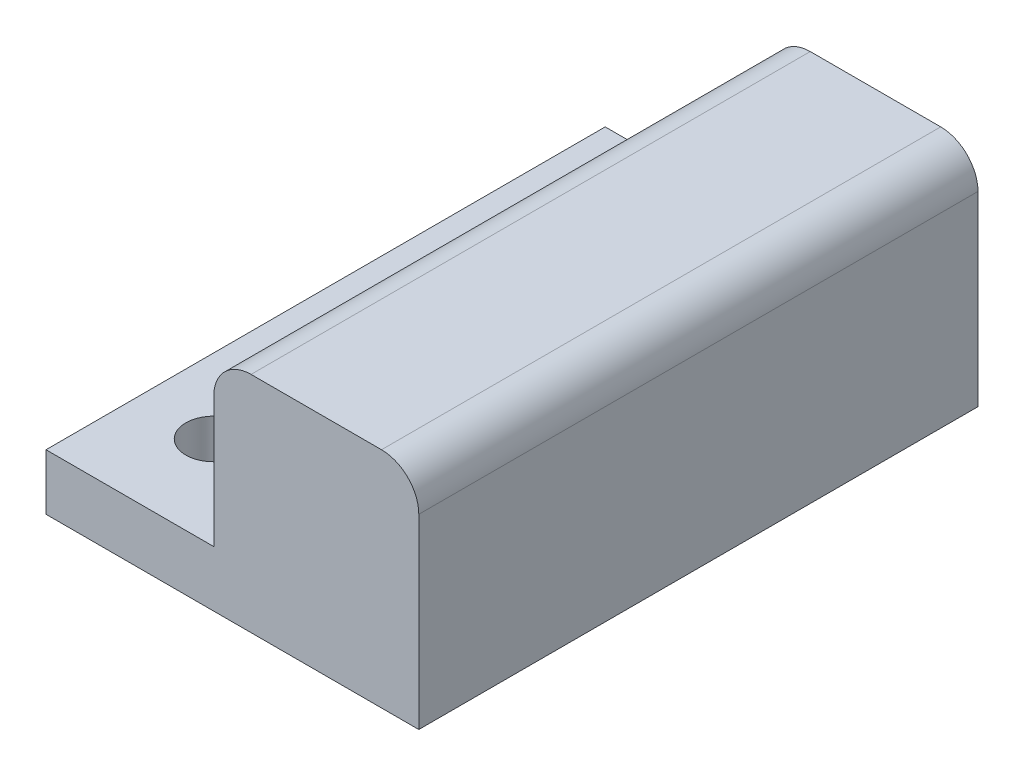
from build123d import *

# Parameters (mm, degrees)
SKETCH1_W           = 25.4
SKETCH1_H           = 38.1
SKETCH1_R           = 1.905
BOSS_EXTRUDE1_DEPTH = 3.81
BOSS_EXTRUDE2_DEPTH = 8.89
SKETCH3_W           = 13.97
SKETCH3_H           = 38.1
BOSS_EXTRUDE3_DEPTH = 2.54
CHAMFER1_SIZE       = 1.27
FILLET1_R           = 2.54


with BuildPart() as part:
    # Sketch1 → Boss-Extrude1 (new body)
    with BuildSketch(Plane(origin=(0, 0, 0), x_dir=(1, 0, 0), z_dir=(0, 1, 0))):
        with Locations((-7.62, -12.7)):
            Rectangle(SKETCH1_W, SKETCH1_H)
        Circle(SKETCH1_R, mode=Mode.SUBTRACT)
        with Locations((0, -25.4)):
            Circle(SKETCH1_R, mode=Mode.SUBTRACT)
    extrude(amount=BOSS_EXTRUDE1_DEPTH)

    # Sketch2 → Boss-Extrude2 (add)
    with BuildSketch(Plane(origin=(0, 3.81, 0), x_dir=(1, 0, 0), z_dir=(0, 1, 0))):
        Polygon((-20.32, 6.35), (-20.32, -31.75), (-6.35, -31.75), (-6.35, 6.35), (-8.89, 6.35), (-8.89, -29.21), (-17.78, -29.21), (-17.78, 6.35), align=None)
    extrude(amount=BOSS_EXTRUDE2_DEPTH)

    # Sketch3 → Boss-Extrude3 (add)
    with BuildSketch(Plane(origin=(0, 12.7, 0), x_dir=(1, 0, 0), z_dir=(0, 1, 0))):
        with Locations((-13.335, -12.7)):
            Rectangle(SKETCH3_W, SKETCH3_H)
    extrude(amount=BOSS_EXTRUDE3_DEPTH)

    # Chamfer1
    chamfer1_edges = [part.edges().sort_by_distance(p)[0] for p in [
        (-8.89, 12.7, 11.43),
        (-17.78, 12.7, 11.43),
    ]]
    chamfer(chamfer1_edges, length=CHAMFER1_SIZE)


with BuildPart() as body_2:
    # Mirror1: mirrored copy
    add(part.part.mirror(Plane(origin=(5.08, 3.81, -6.35), x_dir=(0, 0, 1), z_dir=(-1, 0, 0))))

    # Fillet1
    fillet1_edges = [body_2.edges().sort_by_distance(p)[0] for p in [
        (30.48, 15.24, 12.7),
        (16.51, 15.24, 12.7),
    ]]
    fillet(fillet1_edges, radius=FILLET1_R)


solid = body_2.part
